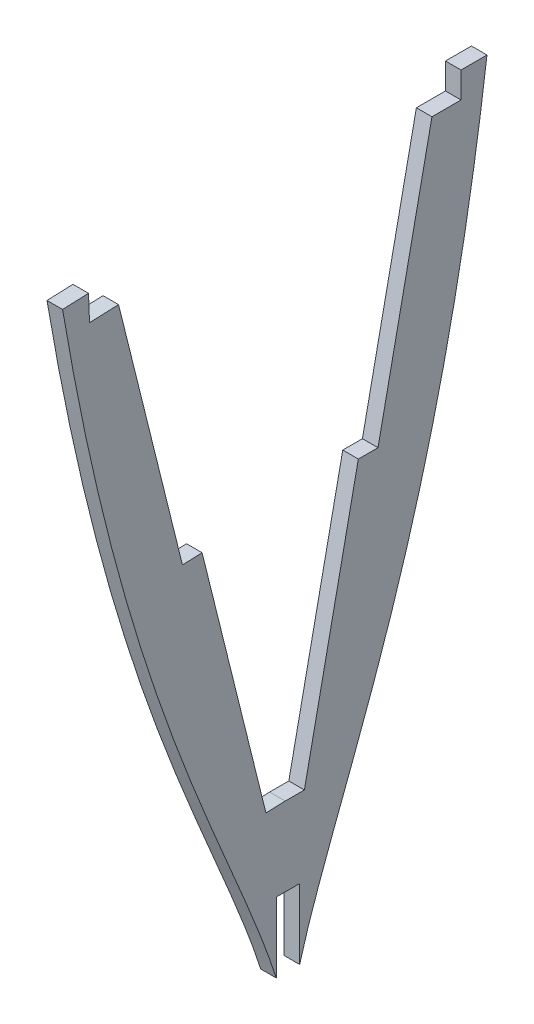
from build123d import *

# Parameters (mm, degrees)
BOSS_EXTRU_3_DEPTH      = 6
ENL_V_MAT_EXTRU_1_DEPTH = 6


with BuildPart() as part:
    # Esquisse2 → Boss.-Extru.3 (new body)
    with BuildSketch(Plane(origin=(0, 0, 0), x_dir=(0, 0, -1), z_dir=(1, 0, 0))):
        with BuildLine():
            Line((74.618394642, 374.988860425), (64.618394642, 374.988860425))
            Line((64.618394642, 374.988860425), (64.618394642, 364.988860425))
            Line((64.618394642, 364.988860425), (53.409489087, 364.988860425))
            Line((53.409489087, 364.988860425), (32.632975645, 264.988860425))
            Line((32.632975645, 264.988860425), (25.05767431, 264.988860425))
            Line((25.05767431, 264.988860425), (4.281160868, 164.988860425))
            Line((4.281160868, 164.988860425), (-3.124683809, 164.988860425))
            Line((-3.124683809, 164.988860425), (-10.525079973, 164.704832246))
            Line((-10.525079973, 164.704832246), (-35.121497553, 263.834443125))
            Line((-35.121497553, 263.834443125), (-42.691225704, 263.543915963))
            Line((-42.691225704, 263.543915963), (-67.287643284, 362.673526842))
            Line((-67.287643284, 362.673526842), (-78.488302395, 362.243644072))
            Line((-78.488302395, 362.243644072), (-78.871821347, 372.236287026))
            Line((-78.871821347, 372.236287026), (-88.864464301, 371.852768075))
            add(Edge.make_bspline(
                [(-88.864464301, 371.852768075), (-60.019522408, 201.464161689), (-14.22678275, 148.31608134), (-1.678548323, 89.602571591)],
                knots=[0, 0, 0, 0, 1, 1, 1, 1], degree=3))
            add(Edge.make_bspline(
                [(74.618394642, 374.988860425), (52.329400068, 203.619351527), (8.608679942, 148.754134114), (-1.678548323, 89.602571591)],
                knots=[0, 0, 0, 0, 1, 1, 1, 1], degree=3))
        make_face()
    extrude(amount=BOSS_EXTRU_3_DEPTH)

    # Esquisse3 → Enlèv. mat.-Extru.1 (cut)
    with BuildSketch(Plane(origin=(6, 0, 0), x_dir=(0, 0, -1), z_dir=(1, 0, 0))):
        Polygon((-6.551065321, 107.676782508), (-6.551065321, 134.676782508), (2.448934679, 134.676782508), (2.448934679, 107.676782508), (29.690319749, 86.957279117), (-22.562762959, 86.957279117), align=None)
    extrude(amount=-ENL_V_MAT_EXTRU_1_DEPTH, mode=Mode.SUBTRACT)


solid = part.part
